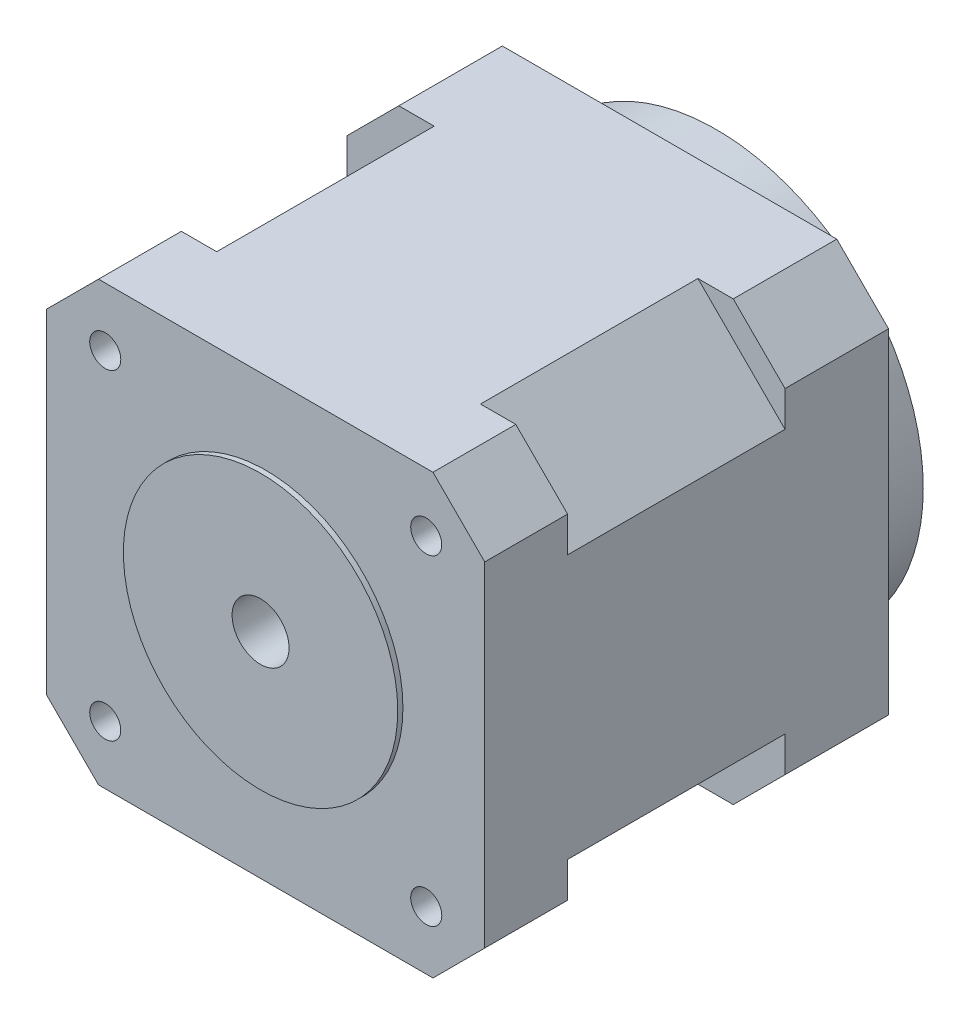
from build123d import *

# Parameters (mm, degrees)
SKETCH2_W               = 42.3
SKETCH2_H               = 42.3
BOSS_EXTRUDE5_DEPTH     = 39
CHAMFER4_SIZE           = 5
CUT_EXTRUDE1_START      = -8
CUT_EXTRUDE1_DEPTH      = 21
SKETCH5_R               = 20
BOSS_EXTRUDE6_DEPTH     = 4.5
SKETCH7_R               = 1.5
CUT_EXTRUDE3_DEPTH      = 4.5
SKETCH8_R               = 13.24793055
BOSS_EXTRUDE7_DEPTH     = 0.5
CUT_EXTRUDE2_DEPTH      = 53.791050378
CUT_EXTRUDE2_DEPTH_BACK = 4.5
SKETCH6_R               = 2.75


with BuildPart() as part:
    # Sketch2 → Boss-Extrude5 (new body)
    with BuildSketch(Plane.XY):
        Rectangle(SKETCH2_W, SKETCH2_H)
    extrude(amount=BOSS_EXTRUDE5_DEPTH)

    # Chamfer4
    chamfer4_edges = [part.edges().sort_by_distance(p)[0] for p in [
        (21.15, -21.15, 19.5),
        (-21.15, -21.15, 19.5),
        (-21.15, 21.15, 19.5),
        (21.15, 21.15, 19.5),
    ]]
    chamfer(chamfer4_edges, length=CHAMFER4_SIZE)

    # Sketch3 → Cut-Extrude1 (cut)
    with BuildSketch(Plane.XY.offset(39).offset(CUT_EXTRUDE1_START)):
        Polygon((-21.15, 21.15), (-21.15, 12.738640345), (-16.944320172, 16.944320172), (-12.738640345, 21.15), align=None)
        Polygon((21.15, -12.738640345), (21.15, -21.15), (12.738640345, -21.15), (16.944320172, -16.944320172), align=None)
        Polygon((12.738640345, 21.15), (21.15, 21.15), (21.15, 12.738640345), (16.944320172, 16.944320172), align=None)
        Polygon((-12.738640345, -21.15), (-21.15, -21.15), (-21.15, -12.738640345), (-16.944320172, -16.944320172), align=None)
    extrude(amount=-CUT_EXTRUDE1_DEPTH, mode=Mode.SUBTRACT)

    # Sketch5 → Boss-Extrude6 (add)
    with BuildSketch(Plane(origin=(0, 0, 0), x_dir=(-1, 0, 0), z_dir=(0, 0, -1))):
        Circle(SKETCH5_R)
    extrude(amount=BOSS_EXTRUDE6_DEPTH)

    # Sketch7 → Cut-Extrude3 (cut)
    with BuildSketch(Plane.XY.offset(39)):
        with Locations((-15.5, 15.5)):
            Circle(SKETCH7_R)
        with Locations((-15.5, -15.5)):
            Circle(SKETCH7_R)
        with Locations((15.5, 15.5)):
            Circle(SKETCH7_R)
        with Locations((15.5, -15.5)):
            Circle(SKETCH7_R)
    extrude(amount=-CUT_EXTRUDE3_DEPTH, mode=Mode.SUBTRACT)

    # Sketch8 → Boss-Extrude7 (add)
    with BuildSketch(Plane.XY.offset(39)):
        Circle(SKETCH8_R)
    extrude(amount=BOSS_EXTRUDE7_DEPTH)

    # Sketch6 → Cut-Extrude2 (cut, two sides: drawn at the far end of the back side and taken through both)
    with BuildSketch(Plane.XY.offset(39).offset(-CUT_EXTRUDE2_DEPTH_BACK)):
        Circle(SKETCH6_R)
    extrude(amount=CUT_EXTRUDE2_DEPTH + CUT_EXTRUDE2_DEPTH_BACK, mode=Mode.SUBTRACT)


solid = part.part
